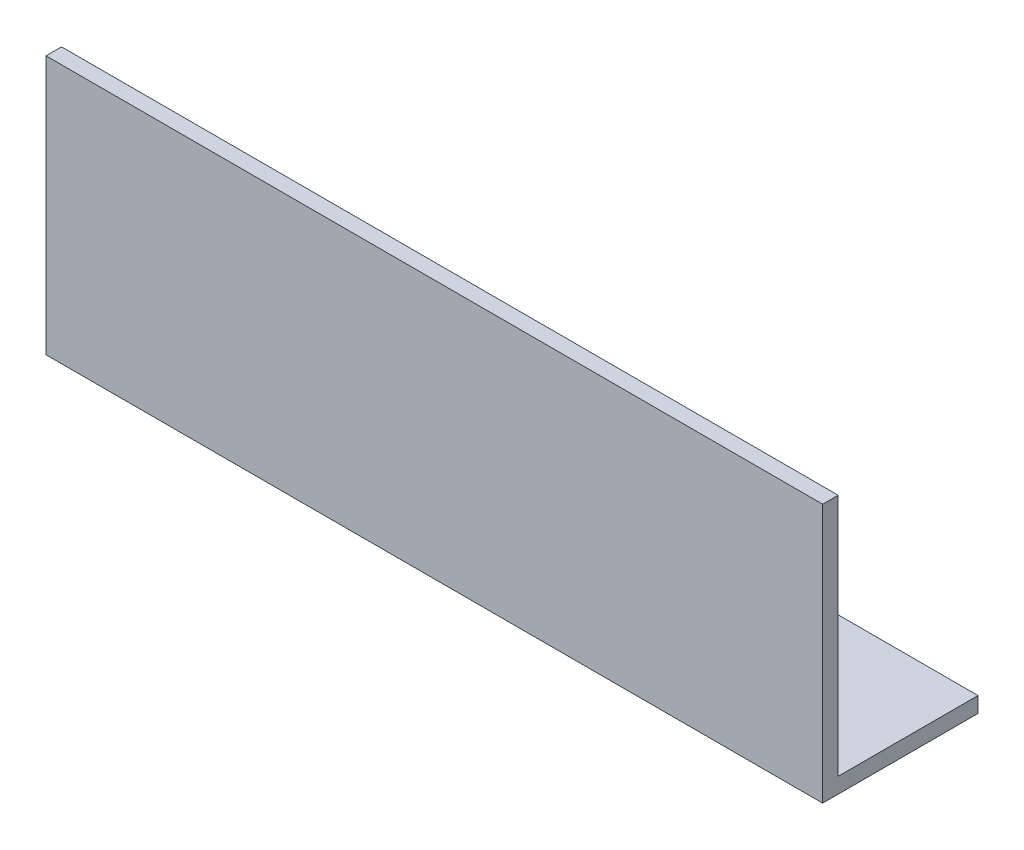
from build123d import *

# Parameters (mm, degrees)
EXTRUDE_1_DEPTH = 150


with BuildPart() as part:
    # Эскиз1 → Вытянуть-Тонкостенный1 (new body)
    with BuildSketch(Plane(origin=(0, 0, 0), x_dir=(0, 0, -1), z_dir=(1, 0, 0))):
        Polygon((30, 0), (0, 0), (0, 50), (3, 50), (3, 3), (30, 3), align=None)
    extrude(amount=EXTRUDE_1_DEPTH)


solid = part.part
